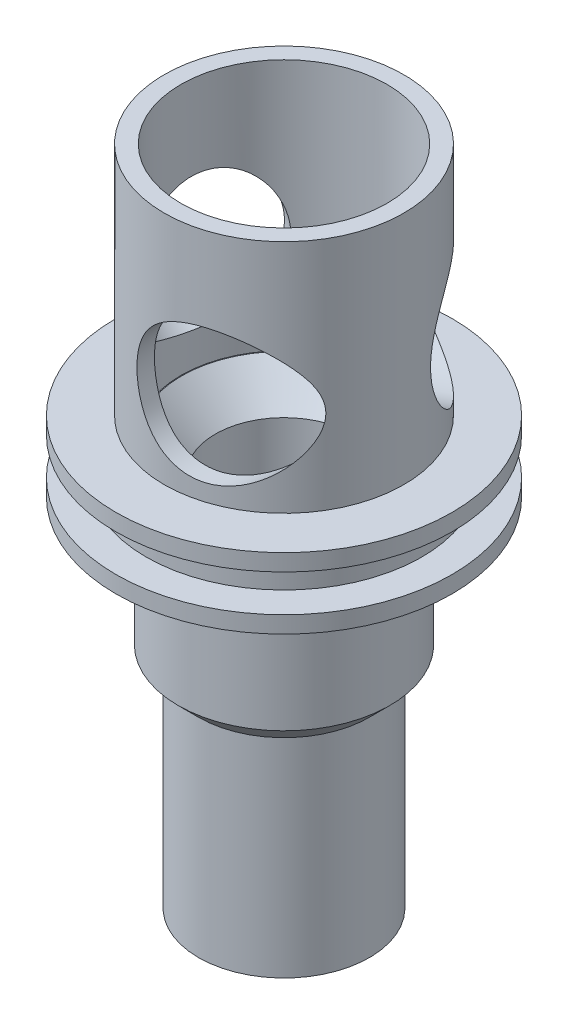
from build123d import *

# Parameters (mm, degrees)
SKETCH2_R                = 12.7
SOLID_CYLINDER_DEPTH     = 50.038
ALL_THROUGH_HOLE_REACH   = 55.164
SKETCH3_R                = 5.19176
SKETCH4_R                = 7.79018
SWIRL_CHAMBER_DEPTH      = 19.05
TOP_START                = -17.78
SKETCH5_R                = 12.7
SKETCH5_R_2              = 9.06018
TOP_OUTER_CUT_DEPTH      = 17.78
SKETCH8_W                = 2.286
SKETCH8_H                = 2.794
SKETCH9_W                = 4.699
SKETCH9_H                = 26.924
INNER_CHAMFER_SIZE       = 2.54
INLET_HOLE_REACH         = 55.164
SKETCH12_R               = 5.08
INLET_HOLE_PATTERN_COUNT = 3


with BuildPart() as part:
    # Sketch2 → Solid Cylinder (new body)
    with BuildSketch(Plane(origin=(0, 0, 0), x_dir=(1, 0, 0), z_dir=(0, 1, 0))):
        Circle(SKETCH2_R)
    extrude(amount=SOLID_CYLINDER_DEPTH)

    # Sketch3 → All Through Hole (cut, up to next)
    with BuildSketch(Plane(origin=(0, 50.038, 0), x_dir=(1, 0, 0), z_dir=(0, 1, 0)), mode=Mode.PRIVATE) as all_through_hole_sk1:
        Circle(SKETCH3_R)
    all_through_hole_tool1 = extrude(all_through_hole_sk1.sketch, amount=-ALL_THROUGH_HOLE_REACH, mode=Mode.PRIVATE) & part.part
    add(all_through_hole_tool1.solids().sort_by_distance((0, 50.038, 0))[0], mode=Mode.SUBTRACT)

    # Sketch4 → Swirl Chamber (cut)
    with BuildSketch(Plane(origin=(0, 50.038, 0), x_dir=(1, 0, 0), z_dir=(0, 1, 0))):
        Circle(SKETCH4_R)
    extrude(amount=-SWIRL_CHAMBER_DEPTH, mode=Mode.SUBTRACT)

    # Sketch5 → Top Outer cut (cut)
    with BuildSketch(Plane(origin=(0, 50.038, 0), x_dir=(1, 0, 0), z_dir=(0, 1, 0)).offset(TOP_START)):
        Circle(SKETCH5_R)
        Circle(SKETCH5_R_2, mode=Mode.SUBTRACT)
    extrude(amount=TOP_OUTER_CUT_DEPTH, mode=Mode.SUBTRACT)

    # Sketch8 → O Ring Cut (revolve, cut)
    with BuildSketch(Plane.XY):
        with Locations((11.557, 29.591)):
            Rectangle(SKETCH8_W, SKETCH8_H)
    revolve(axis=Axis((0, 55, 0), (0, -1, 0)), mode=Mode.SUBTRACT)

    # Sketch9 → Base Support (revolve, cut)
    with BuildSketch(Plane.XY):
        with Locations((10.3505, 13.462)):
            Rectangle(SKETCH9_W, SKETCH9_H)
    revolve(axis=Axis((0, 55, 0), (0, -1, 0)), mode=Mode.SUBTRACT)

    # Inner Chamfer
    inner_chamfer_edges = [part.edges().sort_by_distance(p)[0] for p in [
        (-5.19176, 30.988, 0),
    ]]
    chamfer(inner_chamfer_edges, length=INNER_CHAMFER_SIZE)

    # Sketch12 → Inlet Hole (cut, up to next)
    with BuildSketch(Plane.XY, mode=Mode.PRIVATE) as inlet_hole_sk1:
        with Locations((2.71018, 38.608)):
            Circle(SKETCH12_R)
    inlet_hole_tool1 = extrude(inlet_hole_sk1.sketch, amount=INLET_HOLE_REACH, mode=Mode.PRIVATE) & part.part
    inlet_hole = inlet_hole_tool1.solids().sort_by_distance((2.71018, 38.608, 0))[0]
    add(inlet_hole, mode=Mode.SUBTRACT)

    # Inlet Hole Pattern: Inlet Hole ×3 about axis
    inlet_hole_pattern_axis = Axis((0, 55, 0), (0, -1, 0))
    for i in range(1, INLET_HOLE_PATTERN_COUNT):
        add(inlet_hole.rotate(inlet_hole_pattern_axis, i * 360 / INLET_HOLE_PATTERN_COUNT), mode=Mode.SUBTRACT)

    # Sketch13 → Outer Chamfer and Stem (revolve, cut)
    with BuildSketch(Plane.XY):
        Polygon((-8.001, 0), (-8.001, 17.272), (-6.46176, 15.73276), (-6.46176, 0), align=None)
    revolve(axis=Axis((0, 46.59080533, 0), (0, -1, 0)), mode=Mode.SUBTRACT)


solid = part.part
